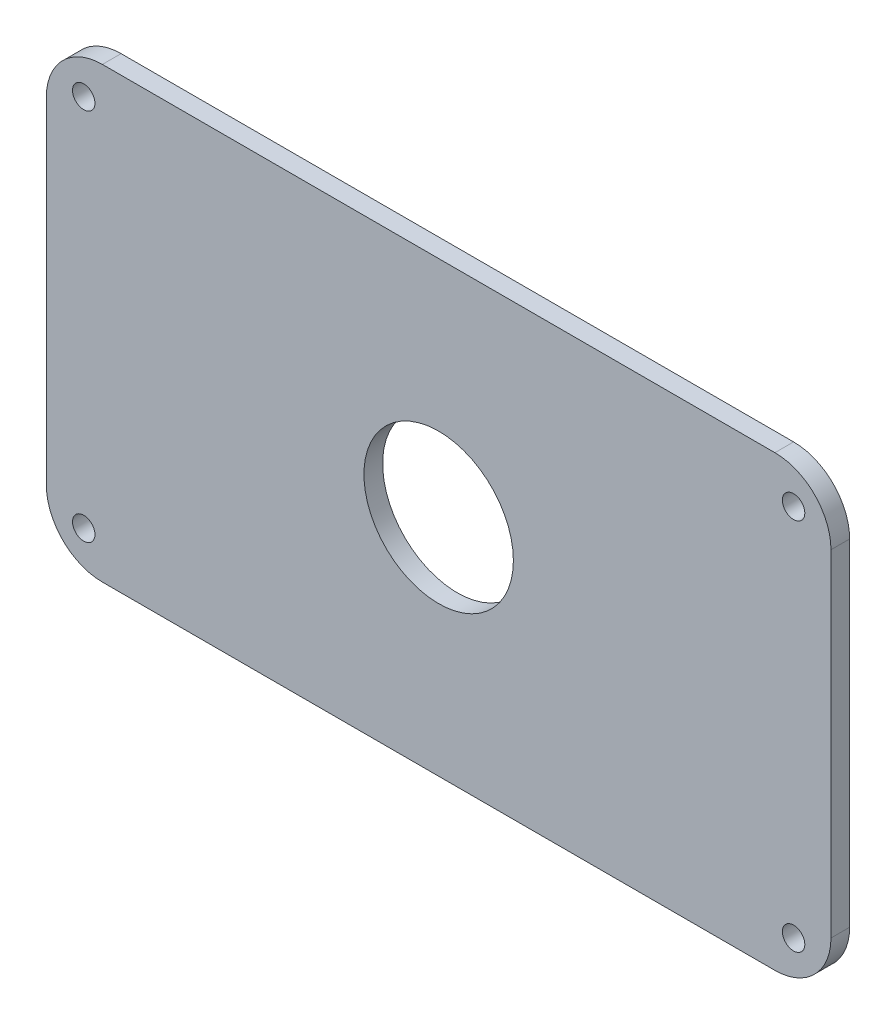
from build123d import *

# Parameters (mm, degrees)
EXTRUDE_1_DEPTH     = 5
SKETCH_2_R          = 20
CUT_EXTRUDE_1_DEPTH = 219.46052275
OTHER_1_OUTLINE_R   = 3
OTHER_1_DEPTH       = 5


# Read off the part's stored shape, not the designer's step: 孔1
with BuildPart() as part:
    # 草图1 → 凸台-拉伸1 (new body)
    with BuildSketch(Plane.XY):
        with BuildLine():
            Line((15, 60), (195, 60))
            ThreePointArc((195, 60), (205.606601718, 55.606601718), (210, 45))
            Line((210, 45), (210, -45))
            ThreePointArc((210, -45), (205.606601718, -55.606601718), (195, -60))
            Line((195, -60), (15, -60))
            ThreePointArc((15, -60), (4.393398282, -55.606601718), (0, -45))
            Line((0, -45), (0, 45))
            ThreePointArc((0, 45), (4.393398282, 55.606601718), (15, 60))
        make_face()
    extrude(amount=EXTRUDE_1_DEPTH)

    # 草图2 → 切除-拉伸1 (cut, through all)
    with BuildSketch(Plane.XY.offset(5)):
        with Locations((105, 0)):
            Circle(SKETCH_2_R)
    extrude(amount=-CUT_EXTRUDE_1_DEPTH, mode=Mode.SUBTRACT)

    # 孔1 outline → 孔1 (cut)
    with BuildSketch(Plane.XY):
        with Locations((10, 50)):
            Circle(OTHER_1_OUTLINE_R)
        with Locations((10, -50)):
            Circle(OTHER_1_OUTLINE_R)
        with Locations((200, -50)):
            Circle(OTHER_1_OUTLINE_R)
        with Locations((200, 50)):
            Circle(OTHER_1_OUTLINE_R)
    extrude(amount=OTHER_1_DEPTH, mode=Mode.SUBTRACT)


solid = part.part
